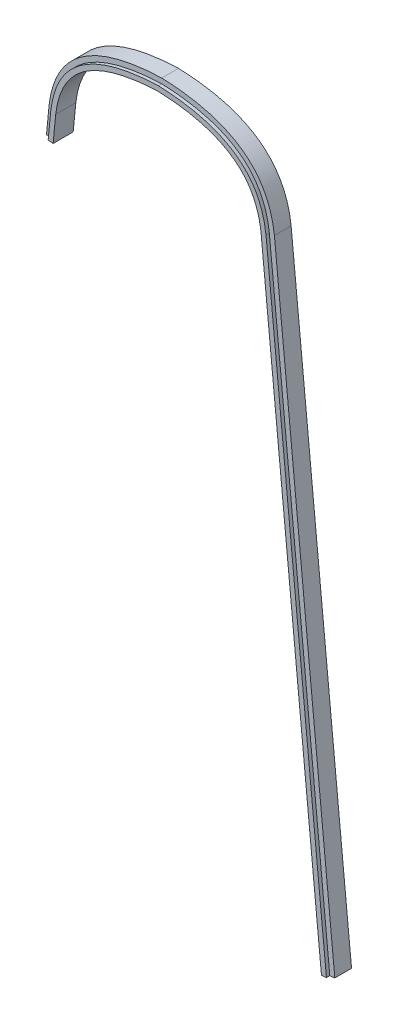
from build123d import *

# Parameters (mm, degrees)
BOSS_EXTRUDE1_DEPTH = 19.05
CUT_EXTRUDE1_START  = -3.175
CUT_EXTRUDE1_DEPTH  = 3.175


# Read off the part's stored shape, not the designer's step: Cut-Extrude1
with BuildPart() as part:
    # Sketch1 → Boss-Extrude1 (new body)
    with BuildSketch(Plane.XY):
        with BuildLine():
            Line((154.716315659, 154.51789158), (97.403993572, 735.828587024))
            add(Edge.make_bspline(
                [(0, 803.26908628), (0.979817658, 803.233925105), (2.950075123, 803.151909058), (6.800362849, 802.946009068), (11.504912112, 802.608232022), (16.957304332, 802.075979486), (23.975792063, 801.198424891), (32.273128008, 799.790052384), (41.46699497, 797.614109593), (49.89784204, 794.967332344), (60.129456963, 790.832450746), (71.050790712, 784.572420078), (79.648241417, 776.932392043), (85.274313562, 769.943199813), (88.89525226, 764.228265264), (91.933130485, 758.00316425), (93.979934001, 752.359286407), (95.321414001, 747.554999291), (96.177362738, 743.805316844), (96.764020616, 740.553537606), (97.155379667, 737.881968465), (97.326205951, 736.51096636), (97.403993572, 735.828587024)],
                knots=[0.000508173, 0.000508173, 0.000508173, 0.000508173, 0.016098161, 0.031688149, 0.062868125, 0.094048101, 0.125228077, 0.187588029, 0.249947981, 0.312307933, 0.374667885, 0.499387789, 0.624107693, 0.686467645, 0.748827597, 0.811187549, 0.873547501, 0.904727477, 0.935907453, 0.967087429, 0.982677417, 0.998267405, 0.998267405, 0.998267405, 0.998267405], degree=3))
            add(Edge.make_bspline(
                [(-97.403993572, 735.828587024), (-97.326205951, 736.51096636), (-97.155379667, 737.881968465), (-96.764020616, 740.553537606), (-96.177362738, 743.805316844), (-95.321414001, 747.554999291), (-93.979934001, 752.359286407), (-91.933130485, 758.00316425), (-88.89525226, 764.228265264), (-85.274313562, 769.943199813), (-79.648241417, 776.932392043), (-71.050790712, 784.572420078), (-60.129456963, 790.832450746), (-49.89784204, 794.967332344), (-41.46699497, 797.614109593), (-32.273128008, 799.790052384), (-23.975792063, 801.198424891), (-16.957304332, 802.075979486), (-11.504912112, 802.608232022), (-6.800362849, 802.946009068), (-2.950075123, 803.151909058), (-0.979817658, 803.233925105), (0, 803.26908628)],
                knots=[0.000508173, 0.000508173, 0.000508173, 0.000508173, 0.016098161, 0.031688149, 0.062868125, 0.094048101, 0.125228077, 0.187588029, 0.249947981, 0.312307933, 0.374667885, 0.499387789, 0.624107693, 0.686467645, 0.748827597, 0.811187549, 0.873547501, 0.904727477, 0.935907453, 0.967087429, 0.982677417, 0.998267405, 0.998267405, 0.998267405, 0.998267405], degree=3))
            Line((-97.403993572, 735.828587024), (-99.889181424, 710.621681669))
            Line((-99.889181424, 710.621681669), (-109.368223301, 711.556235093))
            Line((-109.368223301, 711.556235093), (-106.876080835, 736.833680097))
            add(Edge.make_bspline(
                [(-106.876080835, 736.833680097), (-98.655564568, 809.385111394), (0, 812.8)],
                knots=[0, 0, 0, 1, 1, 1], degree=2))
            add(Edge.make_bspline(
                [(106.876080835, 736.833680097), (98.655564568, 809.385111394), (0, 812.8)],
                knots=[0, 0, 0, 1, 1, 1], degree=2))
            Line((106.876080835, 736.833680097), (164.195357535, 155.452445004))
            Line((164.195357535, 155.452445004), (154.716315659, 154.51789158))
        make_face()
    extrude(amount=BOSS_EXTRUDE1_DEPTH)

    # Cut-Extrude1 outline → Cut-Extrude1 (cut)
    with BuildSketch(Plane.XY.offset(19.05).offset(CUT_EXTRUDE1_START)):
        with BuildLine():
            add(Edge.make_bspline(
                [(1e-09, 807.996472787), (-8.059444459, 807.712436153), (-15.632797496, 807.076135514), (-29.80101283, 805.110989442), (-36.395663836, 803.782123865), (-48.604448115, 800.45028743), (-54.21823512, 798.447532439), (-64.476247681, 793.79089402), (-69.120337781, 791.137665272), (-77.472024822, 785.195018143), (-81.180369592, 781.906189414), (-87.708823445, 774.677407428), (-90.530051439, 770.736815263), (-95.315640606, 762.156711157), (-97.279926716, 757.51598974), (-100.345590506, 747.487649134), (-101.446143015, 742.099771544), (-102.102109164, 736.327515765)],
                knots=[0, 0, 0, 0, 0.125, 0.125, 0.25, 0.25, 0.375, 0.375, 0.5, 0.5, 0.625, 0.625, 0.75, 0.75, 0.875, 0.875, 1, 1, 1, 1], degree=3))
            add(Edge.make_bspline(
                [(102.102109165, 736.32751576), (101.446143015, 742.099771539), (100.345590507, 747.487649129), (97.279926717, 757.515989736), (95.315640608, 762.156711153), (90.530051441, 770.73681526), (87.708823448, 774.677407425), (81.180369595, 781.906189411), (77.472024825, 785.195018141), (69.120337784, 791.137665271), (64.476247684, 793.790894018), (54.218235123, 798.447532438), (48.604448118, 800.450287429), (36.395663839, 803.782123864), (29.801012833, 805.110989442), (15.632797499, 807.076135513), (8.059444462, 807.712436153), (1e-09, 807.996472787)],
                knots=[0, 0, 0, 0, 0.125, 0.125, 0.25, 0.25, 0.375, 0.375, 0.5, 0.5, 0.625, 0.625, 0.75, 0.75, 0.875, 0.875, 1, 1, 1, 1], degree=3))
            Line((102.102109165, 736.32751576), (159.417920429, 154.981430078))
            Line((159.417920429, 154.981430078), (164.195357535, 155.452445004))
            Line((164.195357535, 155.452445004), (106.876080835, 736.833680097))
            add(Edge.make_bspline(
                [(106.876080835, 736.833680097), (98.655564568, 809.385111394), (0, 812.8)],
                knots=[0, 0, 0, 1, 1, 1], degree=2))
            add(Edge.make_bspline(
                [(0, 812.8), (-98.655564568, 809.385111394), (-106.876080835, 736.833680097)],
                knots=[0, 0, 0, 1, 1, 1], degree=2))
            Line((-106.876080835, 736.833680097), (-109.368223301, 711.556235093))
            Line((-109.368223301, 711.556235093), (-104.590786195, 711.085220167))
            Line((-104.590786195, 711.085220167), (-102.102109164, 736.327515765))
        make_face()
    extrude(amount=CUT_EXTRUDE1_DEPTH, mode=Mode.SUBTRACT)


solid = part.part
